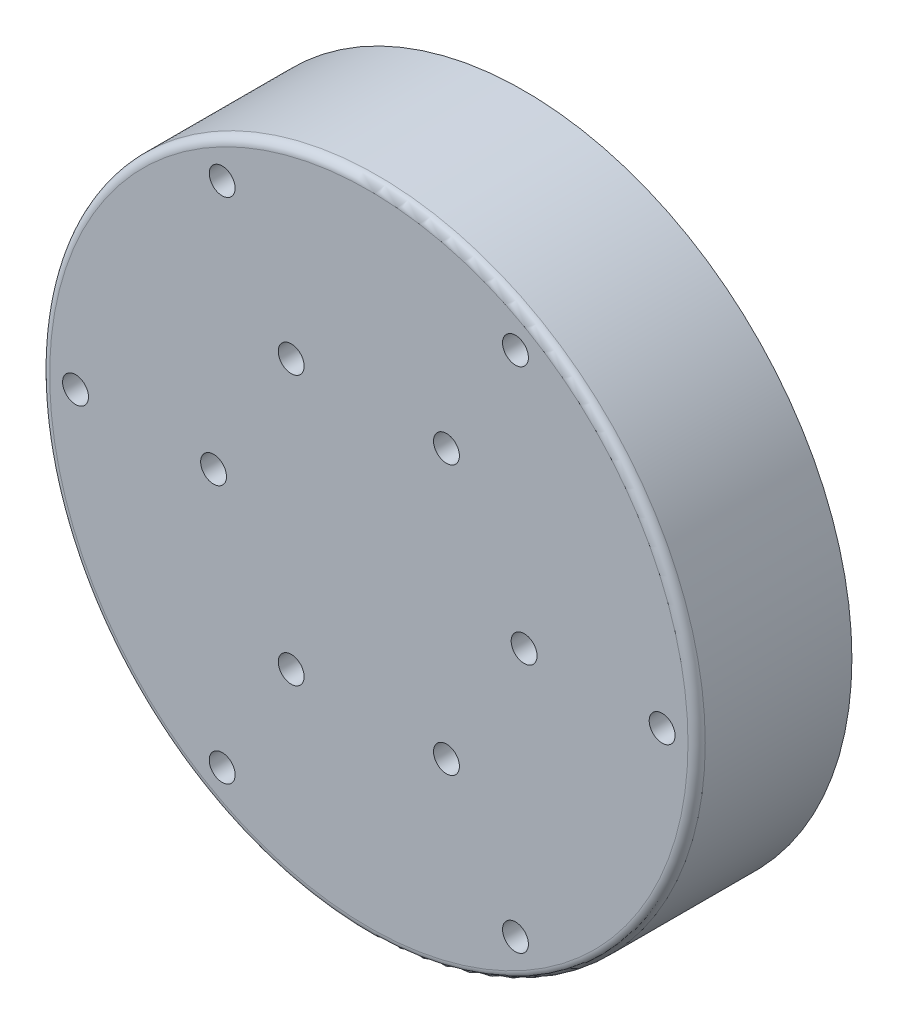
from build123d import *

# Parameters (mm, degrees)
SKETCH_1_R          = 38
EXTRUDE_1_DEPTH     = 18
CUT_EXTRUDE_1_REACH = 58.675
SKETCH_2_R          = 1.5
CUT_EXTRUDE_2_DEPTH = 12.5
FILLET_1_R          = 1
CUT_EXTRUDE_7_REACH = 79.414
SKETCH_6_W          = 20
SKETCH_6_H          = 4
CUT_EXTRUDE_8_REACH = 58.675
SKETCH_7_R          = 1.5


with BuildPart() as part:
    # Эскиз1 → Бобышка-Вытянуть1 (new body)
    with BuildSketch(Plane.XY):
        Circle(SKETCH_1_R)
    extrude(amount=EXTRUDE_1_DEPTH)

    # Эскиз2 → Вырез-Вытянуть1 (cut, up to next)
    with BuildSketch(Plane.XY.offset(18), mode=Mode.PRIVATE) as cut_extrude_1_sk1:
        with Locations((-34, 0)):
            Circle(SKETCH_2_R)
    cut_extrude_1_tool1 = extrude(cut_extrude_1_sk1.sketch, amount=-CUT_EXTRUDE_1_REACH, mode=Mode.PRIVATE) & part.part
    # Эскиз2 → Вырез-Вытянуть1 (cut, up to next)
    with BuildSketch(Plane.XY.offset(18), mode=Mode.PRIVATE) as cut_extrude_1_sk2:
        with Locations((-17, 29.444863729)):
            Circle(SKETCH_2_R)
    cut_extrude_1_tool2 = extrude(cut_extrude_1_sk2.sketch, amount=-CUT_EXTRUDE_1_REACH, mode=Mode.PRIVATE) & part.part
    # Эскиз2 → Вырез-Вытянуть1 (cut, up to next)
    with BuildSketch(Plane.XY.offset(18), mode=Mode.PRIVATE) as cut_extrude_1_sk3:
        with Locations((17, 29.444863729)):
            Circle(SKETCH_2_R)
    cut_extrude_1_tool3 = extrude(cut_extrude_1_sk3.sketch, amount=-CUT_EXTRUDE_1_REACH, mode=Mode.PRIVATE) & part.part
    # Эскиз2 → Вырез-Вытянуть1 (cut, up to next)
    with BuildSketch(Plane.XY.offset(18), mode=Mode.PRIVATE) as cut_extrude_1_sk4:
        with Locations((34, 0)):
            Circle(SKETCH_2_R)
    cut_extrude_1_tool4 = extrude(cut_extrude_1_sk4.sketch, amount=-CUT_EXTRUDE_1_REACH, mode=Mode.PRIVATE) & part.part
    # Эскиз2 → Вырез-Вытянуть1 (cut, up to next)
    with BuildSketch(Plane.XY.offset(18), mode=Mode.PRIVATE) as cut_extrude_1_sk5:
        with Locations((17, -29.444863729)):
            Circle(SKETCH_2_R)
    cut_extrude_1_tool5 = extrude(cut_extrude_1_sk5.sketch, amount=-CUT_EXTRUDE_1_REACH, mode=Mode.PRIVATE) & part.part
    # Эскиз2 → Вырез-Вытянуть1 (cut, up to next)
    with BuildSketch(Plane.XY.offset(18), mode=Mode.PRIVATE) as cut_extrude_1_sk6:
        with Locations((-17, -29.444863729)):
            Circle(SKETCH_2_R)
    cut_extrude_1_tool6 = extrude(cut_extrude_1_sk6.sketch, amount=-CUT_EXTRUDE_1_REACH, mode=Mode.PRIVATE) & part.part
    add(cut_extrude_1_tool1.solids().sort_by_distance((-34, 0, 18))[0], mode=Mode.SUBTRACT)
    add(cut_extrude_1_tool2.solids().sort_by_distance((-17, 29.444864, 18))[0], mode=Mode.SUBTRACT)
    add(cut_extrude_1_tool3.solids().sort_by_distance((17, 29.444864, 18))[0], mode=Mode.SUBTRACT)
    add(cut_extrude_1_tool4.solids().sort_by_distance((34, 0, 18))[0], mode=Mode.SUBTRACT)
    add(cut_extrude_1_tool5.solids().sort_by_distance((17, -29.444864, 18))[0], mode=Mode.SUBTRACT)
    add(cut_extrude_1_tool6.solids().sort_by_distance((-17, -29.444864, 18))[0], mode=Mode.SUBTRACT)

    # Эскиз3 → Вырез-Вытянуть2 (cut)
    with BuildSketch(Plane(origin=(0, 0, 0), x_dir=(-1, 0, 0), z_dir=(0, 0, -1))):
        with BuildLine():
            Line((-13.076696831, -27), (13.076696831, -27))
            ThreePointArc((13.076696831, -27), (0, 30), (-13.076696831, -27))
        make_face()
    extrude(amount=-CUT_EXTRUDE_2_DEPTH, mode=Mode.SUBTRACT)

    # Скругление1
    fillet_1_edges = [part.edges().sort_by_distance(p)[0] for p in [
        (-38, 0, 18),
    ]]
    fillet(fillet_1_edges, radius=FILLET_1_R)

    # Эскиз6 → Вырез-Вытянуть7 (cut, up to next)
    with BuildSketch(Plane(origin=(0, -27, 0), x_dir=(1, 0, 0), z_dir=(0, 1, 0)), mode=Mode.PRIVATE) as cut_extrude_7_sk1:
        with Locations((0, -10.5)):
            Rectangle(SKETCH_6_W, SKETCH_6_H)
    cut_extrude_7_tool1 = extrude(cut_extrude_7_sk1.sketch, amount=-CUT_EXTRUDE_7_REACH, mode=Mode.PRIVATE) & part.part
    add(cut_extrude_7_tool1.solids().sort_by_distance((0, -27, 10.5))[0], mode=Mode.SUBTRACT)

    # Эскиз7 → Вырез-Вытянуть8 (cut, up to next)
    with BuildSketch(Plane.XY.offset(18), mode=Mode.PRIVATE) as cut_extrude_8_sk1:
        with Locations((-18, 0)):
            Circle(SKETCH_7_R)
    cut_extrude_8_tool1 = extrude(cut_extrude_8_sk1.sketch, amount=-CUT_EXTRUDE_8_REACH, mode=Mode.PRIVATE) & part.part
    # Эскиз7 → Вырез-Вытянуть8 (cut, up to next)
    with BuildSketch(Plane.XY.offset(18), mode=Mode.PRIVATE) as cut_extrude_8_sk2:
        with Locations((-9, 15.588457268)):
            Circle(SKETCH_7_R)
    cut_extrude_8_tool2 = extrude(cut_extrude_8_sk2.sketch, amount=-CUT_EXTRUDE_8_REACH, mode=Mode.PRIVATE) & part.part
    # Эскиз7 → Вырез-Вытянуть8 (cut, up to next)
    with BuildSketch(Plane.XY.offset(18), mode=Mode.PRIVATE) as cut_extrude_8_sk3:
        with Locations((9, 15.588457268)):
            Circle(SKETCH_7_R)
    cut_extrude_8_tool3 = extrude(cut_extrude_8_sk3.sketch, amount=-CUT_EXTRUDE_8_REACH, mode=Mode.PRIVATE) & part.part
    # Эскиз7 → Вырез-Вытянуть8 (cut, up to next)
    with BuildSketch(Plane.XY.offset(18), mode=Mode.PRIVATE) as cut_extrude_8_sk4:
        with Locations((18, 0)):
            Circle(SKETCH_7_R)
    cut_extrude_8_tool4 = extrude(cut_extrude_8_sk4.sketch, amount=-CUT_EXTRUDE_8_REACH, mode=Mode.PRIVATE) & part.part
    # Эскиз7 → Вырез-Вытянуть8 (cut, up to next)
    with BuildSketch(Plane.XY.offset(18), mode=Mode.PRIVATE) as cut_extrude_8_sk5:
        with Locations((9, -15.588457268)):
            Circle(SKETCH_7_R)
    cut_extrude_8_tool5 = extrude(cut_extrude_8_sk5.sketch, amount=-CUT_EXTRUDE_8_REACH, mode=Mode.PRIVATE) & part.part
    # Эскиз7 → Вырез-Вытянуть8 (cut, up to next)
    with BuildSketch(Plane.XY.offset(18), mode=Mode.PRIVATE) as cut_extrude_8_sk6:
        with Locations((-9, -15.588457268)):
            Circle(SKETCH_7_R)
    cut_extrude_8_tool6 = extrude(cut_extrude_8_sk6.sketch, amount=-CUT_EXTRUDE_8_REACH, mode=Mode.PRIVATE) & part.part
    add(cut_extrude_8_tool1.solids().sort_by_distance((-18, 0, 18))[0], mode=Mode.SUBTRACT)
    add(cut_extrude_8_tool2.solids().sort_by_distance((-9, 15.588457, 18))[0], mode=Mode.SUBTRACT)
    add(cut_extrude_8_tool3.solids().sort_by_distance((9, 15.588457, 18))[0], mode=Mode.SUBTRACT)
    add(cut_extrude_8_tool4.solids().sort_by_distance((18, 0, 18))[0], mode=Mode.SUBTRACT)
    add(cut_extrude_8_tool5.solids().sort_by_distance((9, -15.588457, 18))[0], mode=Mode.SUBTRACT)
    add(cut_extrude_8_tool6.solids().sort_by_distance((-9, -15.588457, 18))[0], mode=Mode.SUBTRACT)


solid = part.part
